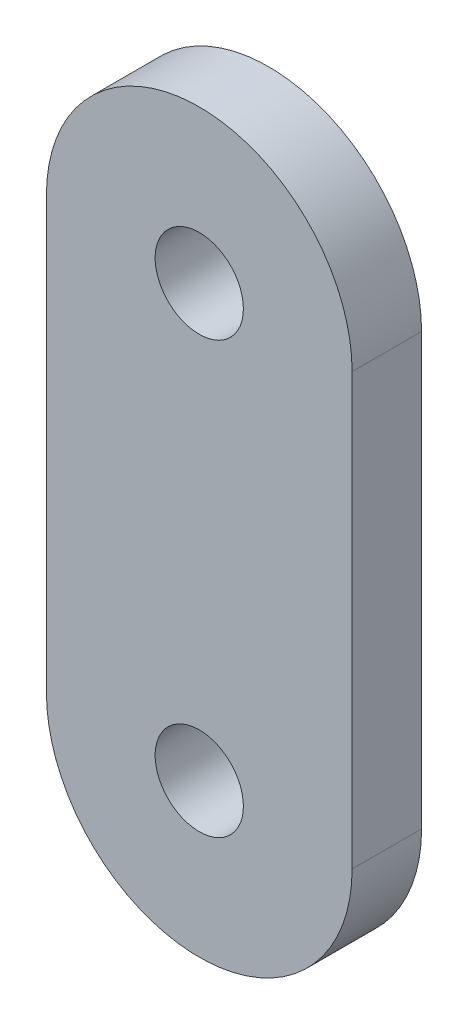
from build123d import *

# Parameters (mm, degrees)
SKETCH1_R           = 3.175
BOSS_EXTRUDE1_DEPTH = 5


with BuildPart() as part:
    # Sketch1 → Boss-Extrude1 (new body)
    with BuildSketch(Plane.XY):
        with BuildLine():
            Line((11, 0), (11, 31))
            ThreePointArc((11, 31), (0, 42), (-11, 31))
            Line((-11, 31), (-11, 0))
            ThreePointArc((-11, 0), (0, -11), (11, 0))
        make_face()
        Circle(SKETCH1_R, mode=Mode.SUBTRACT)
        with Locations((0, 31)):
            Circle(SKETCH1_R, mode=Mode.SUBTRACT)
    extrude(amount=BOSS_EXTRUDE1_DEPTH)


solid = part.part
